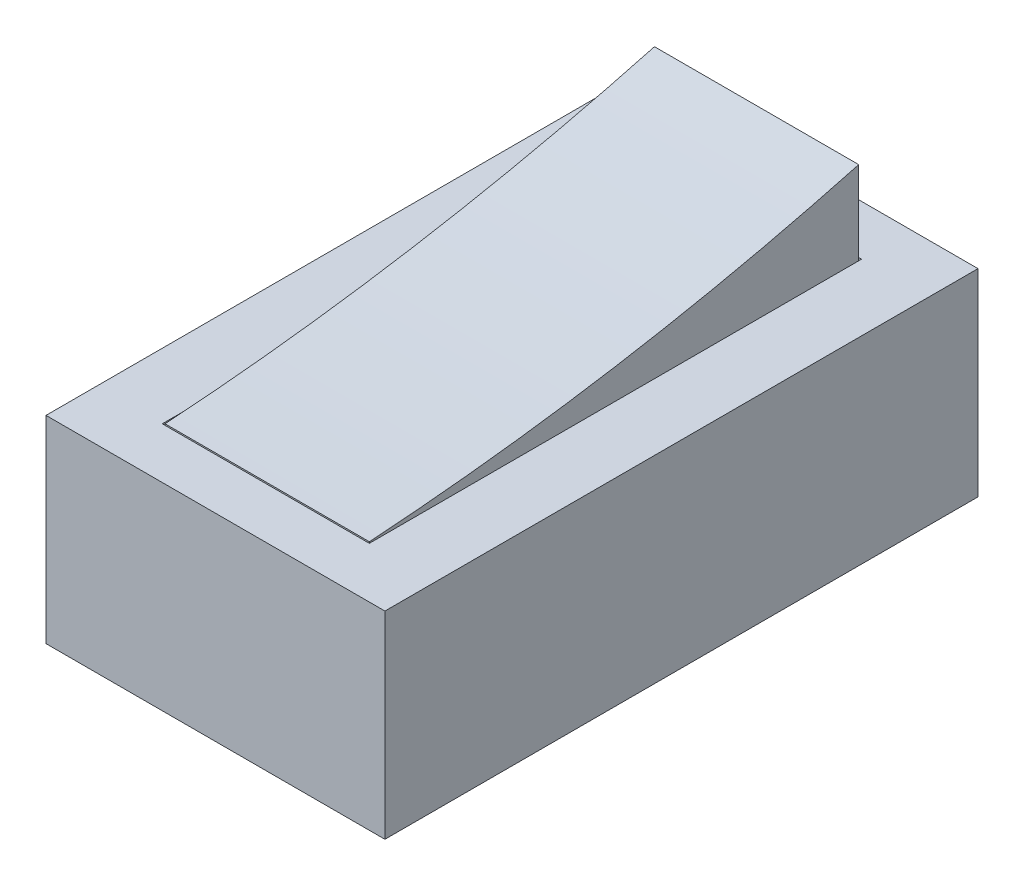
from build123d import *

# Parameters (mm, degrees)
SKETCH1_W           = 12
SKETCH1_H           = 21
BOSS_EXTRUDE1_DEPTH = 7
SKETCH3_W           = 7.332600984
SKETCH3_H           = 17.427465336
SKETCH3_W_2         = 7.232600984
SKETCH3_H_2         = 17.327465336
CUT_EXTRUDE1_DEPTH  = 7
SKETCH4_W           = 7.232600984
SKETCH4_H           = 17.327465336
BOSS_EXTRUDE3_DEPTH = 7
CUT_EXTRUDE3_START  = -7.232600984
CUT_EXTRUDE3_DEPTH  = 7.232600984


# Read off the part's stored shape, not the designer's step: Cut-Extrude3
with BuildPart() as part:
    # Sketch1 → Boss-Extrude1 (new body)
    with BuildSketch(Plane(origin=(0, 0, 0), x_dir=(1, 0, 0), z_dir=(0, 1, 0))):
        Rectangle(SKETCH1_W, SKETCH1_H)
    extrude(amount=BOSS_EXTRUDE1_DEPTH)

    # Sketch3 → Cut-Extrude1 (cut)
    with BuildSketch(Plane(origin=(0, 7, 0), x_dir=(1, 0, 0), z_dir=(0, 1, 0))):
        with Locations((-0.017596075, 0.014058571)):
            Rectangle(SKETCH3_W, SKETCH3_H)
        with Locations((-0.017596075, 0.014058571)):
            Rectangle(SKETCH3_W_2, SKETCH3_H_2, mode=Mode.SUBTRACT)
    extrude(amount=-CUT_EXTRUDE1_DEPTH, mode=Mode.SUBTRACT)


with BuildPart() as cut_extrude1_piece_1:
    # of the separate pieces the step leaves, piece 1, a body of its own (cut_extrude1_pieces)
    add(part.part.solids().sort_by_distance((3.598704417, 0, 8.649674097))[0])

    # Sketch4 → Boss-Extrude3 (add)
    with BuildSketch(Plane(origin=(0, 7, 0), x_dir=(1, 0, 0), z_dir=(0, 1, 0))):
        with Locations((-0.017596075, 0.014058571)):
            Rectangle(SKETCH4_W, SKETCH4_H)
    extrude(amount=BOSS_EXTRUDE3_DEPTH)

    # Cut-Extrude3 outline → Cut-Extrude3 (cut)
    with BuildSketch(Plane(origin=(3.598704417, 0, 0), x_dir=(0, 0, -1), z_dir=(1, 0, 0)).offset(CUT_EXTRUDE3_START)):
        with BuildLine():
            Line((-8.649674097, 14), (-8.649674097, 7.000001761))
            ThreePointArc((-8.649674097, 7.000001761), (0.086046227, 8.019591461), (8.677791239, 9.89956231))
            Line((8.677791239, 9.89956231), (8.677791239, 14))
            Line((8.677791239, 14), (-8.649674097, 14))
        make_face()
    extrude(amount=CUT_EXTRUDE3_DEPTH, mode=Mode.SUBTRACT)


with BuildPart() as cut_extrude1_piece_2:
    # of the separate pieces the step leaves, piece 2, a body of its own (cut_extrude1_pieces)
    add(part.part.solids().sort_by_distance((-6, 0, -10.5))[0])


solid = Compound([cut_extrude1_piece_1.part, cut_extrude1_piece_2.part])
